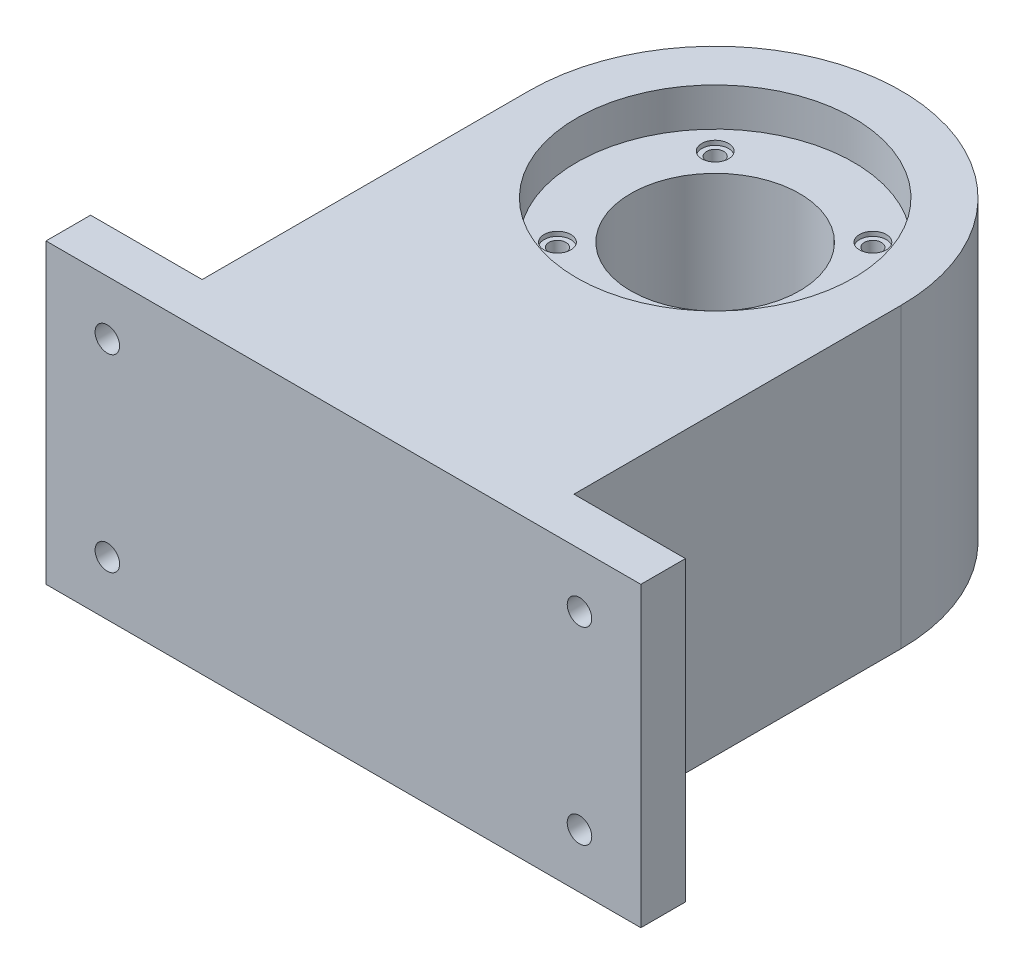
from build123d import *

# Parameters (mm, degrees)
EXTRUDE_1_DEPTH          = 80
SKETCH_3_R               = 37.25
CUT_EXTRUDE_1_DEPTH      = 10.3
SKETCH_4_R               = 22.7
CUT_EXTRUDE_2_DEPTH      = 65
CUT_EXTRUDE_3_DEPTH      = 138.477270849
SKETCH_6_W               = 160
SKETCH_6_H               = 12
EXTRUDE_2_DEPTH          = 80
SKETCH_8_R               = 5.5
CUT_EXTRUDE_4_DEPTH      = 6.8
SKETCH_9_R               = 3.3
CUT_EXTRUDE_5_DEPTH      = 179.44887223
RIB_START                = -5
RIB_1_DEPTH              = 10
PATTERN_CIRCULAR_1_COUNT = 4
EXTRUDE_3_DEPTH          = 0.1
EXTRUDE_4_DEPTH          = 0.2


# Read off the part's stored shape, not the designer's step: 筋1, 高级异型孔1, 高级异型孔2
with BuildPart() as part:
    # 草图1 → 凸台-拉伸1 (new body)
    with BuildSketch(Plane(origin=(0, 0, 0), x_dir=(1, 0, 0), z_dir=(0, 1, 0))):
        with BuildLine():
            Line((-50, -100), (0, -100))
            Line((0, -100), (0, -37.3))
            ThreePointArc((0, -37.3), (-37.3, 0), (0, 37.3))
            Line((0, 37.3), (0, 60))
            Line((0, 60), (-50, 60))
            Line((-50, 60), (-50, -100))
        make_face()
        with BuildLine():
            Line((0, -37.3), (0, -100))
            Line((0, -100), (50, -100))
            Line((50, -100), (50, 60))
            Line((50, 60), (0, 60))
            Line((0, 60), (0, 37.3))
            ThreePointArc((0, 37.3), (26.375082938, 26.375082938), (37.3, 0))
            ThreePointArc((37.3, 0), (26.375082938, -26.375082938), (0, -37.3))
        make_face()
        with BuildLine():
            ThreePointArc((0, 37.3), (-37.3, 0), (0, -37.3))
            Line((0, -37.3), (0, -16))
            ThreePointArc((0, -16), (-16, 0), (0, 16))
            Line((0, 16), (0, 37.3))
        make_face()
        with BuildLine():
            Line((0, -16), (0, -37.3))
            ThreePointArc((0, -37.3), (26.375082938, -26.375082938), (37.3, 0))
            ThreePointArc((37.3, 0), (26.375082938, 26.375082938), (0, 37.3))
            Line((0, 37.3), (0, 16))
            ThreePointArc((0, 16), (11.313708499, 11.313708499), (16, 0))
            ThreePointArc((16, 0), (11.313708499, -11.313708499), (0, -16))
        make_face()
    extrude(amount=EXTRUDE_1_DEPTH)

    # 草图3 → 切除-拉伸1 (cut)
    with BuildSketch(Plane(origin=(0, 80, 0), x_dir=(1, 0, 0), z_dir=(0, 1, 0))):
        with Locations(Location((0, 0, 0), (0, 0, 270))):
            Circle(SKETCH_3_R)
    extrude(amount=-CUT_EXTRUDE_1_DEPTH, mode=Mode.SUBTRACT)

    # 草图4 → 切除-拉伸2 (cut)
    with BuildSketch(Plane(origin=(0, 80, 0), x_dir=(1, 0, 0), z_dir=(0, 1, 0))):
        with Locations(Location((0, 0, 0), (0, 0, 270))):
            Circle(SKETCH_4_R)
    extrude(amount=-CUT_EXTRUDE_2_DEPTH, mode=Mode.SUBTRACT)

    # 草图5 → 切除-拉伸3 (cut, through all)
    with BuildSketch(Plane(origin=(0, 80, 0), x_dir=(1, 0, 0), z_dir=(0, 1, 0))):
        with BuildLine():
            ThreePointArc((-50, 1.43e-07), (7.1e-08, 50), (50, 0))
            Line((50, 0), (50, 60))
            Line((50, 60), (-50, 60))
            Line((-50, 60), (-50, 1.43e-07))
        make_face()
    extrude(amount=-CUT_EXTRUDE_3_DEPTH, mode=Mode.SUBTRACT)

    # 草图6 → 凸台-拉伸2 (add)
    with BuildSketch(Plane(origin=(0, 80, 0), x_dir=(1, 0, 0), z_dir=(0, 1, 0))):
        with Locations((0, -94)):
            Rectangle(SKETCH_6_W, SKETCH_6_H)
    extrude(amount=-EXTRUDE_2_DEPTH)

    # 草图8 → 切除-拉伸4 (cut)
    with BuildSketch(Plane(origin=(0, 0, 88), x_dir=(-1, 0, 0), z_dir=(0, 0, -1))):
        with Locations((63.5, 65.4)):
            Circle(SKETCH_8_R)
        with Locations(Location((63.5, 14.6, 0), (0, 0, 180))):
            Circle(SKETCH_8_R)
    cut_extrude_4 = extrude(amount=-CUT_EXTRUDE_4_DEPTH, mode=Mode.SUBTRACT)

    # 草图9 → 切除-拉伸5 (cut, through all)
    with BuildSketch(Plane(origin=(0, 0, 88), x_dir=(-1, 0, 0), z_dir=(0, 0, -1))):
        with Locations((63.5, 65.4)):
            Circle(SKETCH_9_R)
        with Locations((63.5, 14.6)):
            Circle(SKETCH_9_R)
    cut_extrude_5 = extrude(amount=-CUT_EXTRUDE_5_DEPTH, mode=Mode.SUBTRACT)

    # 镜向1: 切除-拉伸4, 切除-拉伸5 across plane
    add(cut_extrude_4.mirror(Plane(origin=(0, 0, 0), x_dir=(0, 0, 1), z_dir=(1, 0, 0))), mode=Mode.SUBTRACT)
    add(cut_extrude_5.mirror(Plane(origin=(0, 0, 0), x_dir=(0, 0, 1), z_dir=(1, 0, 0))), mode=Mode.SUBTRACT)

    # 筋1 outline → 筋1 (add)
    with BuildSketch(Plane(origin=(0, 40, 0), x_dir=(1, 0, 0), z_dir=(0, 1, 0)).offset(RIB_START)):
        Polygon((-50, -58), (-80, -88), (-50, -88), align=None)
    rib_1 = extrude(amount=RIB_1_DEPTH)

    # 镜向2: 筋1 across plane
    add(rib_1.mirror(Plane(origin=(0, 0, 0), x_dir=(0, 0, 1), z_dir=(1, 0, 0))))

    # 高级异型孔1 outline → 高级异型孔1 (revolve, cut)
    with BuildSketch(Plane(origin=(21.213203436, 0, -21.213203436), x_dir=(1, 0, 0), z_dir=(0, 0, 1))):
        Polygon((2.3, 68.5), (3.6, 68.5), (3.6, 69.7), (0, 69.7), (0, 57.11802058), (2.3, 58.5), align=None)
    other_1 = revolve(axis=Axis((21.213203436, 0, -21.213203436), (0, 1, 0)), mode=Mode.SUBTRACT)

    # 阵列(圆周)1: 高级异型孔1 ×4 about axis
    pattern_circular_1_axis = Axis((0, 0, 0), (0, 1, 0))
    for i in range(1, PATTERN_CIRCULAR_1_COUNT):
        add(other_1.rotate(pattern_circular_1_axis, i * 360 / PATTERN_CIRCULAR_1_COUNT), mode=Mode.SUBTRACT)

    # 高级异型孔2 outline → 高级异型孔2 (revolve, cut)
    with BuildSketch(Plane(origin=(15, 0, 55), x_dir=(1, 0, 0), z_dir=(0, 0, 1))):
        Polygon((3.6, 0), (3.6, 1.5), (2.3, 1.5), (2.3, 11.5), (0, 12.88197942), (0, 0), align=None)
    revolve(axis=Axis((15, 0, 55), (0, 1, 0)), mode=Mode.SUBTRACT)

    # Other 2 2 outline → Other 2 2 (revolve, cut)
    with BuildSketch(Plane(origin=(-15, 0, 55), x_dir=(1, 0, 0), z_dir=(0, 0, 1))):
        Polygon((0, 0), (3.6, 0), (3.6, 1.5), (2.3, 1.5), (2.3, 11.5), (0, 12.88197942), align=None)
    revolve(axis=Axis((-15, 0, 55), (0, 1, 0)), mode=Mode.SUBTRACT)

    # 草图14 → 凸台-拉伸3 (add)
    with BuildSketch(Plane.XZ.offset(-1.5)):
        with BuildLine():
            Line((-16.327905619, 57.3), (-15.607120186, 58.548436991))
            ThreePointArc((-15.607120186, 58.548436991), (-16.8, 58.117691454), (-17.769476485, 57.3))
            Line((-17.769476485, 57.3), (-16.327905619, 57.3))
        make_face()
        with BuildLine():
            Line((-17.655811238, 55), (-16.327905619, 57.3))
            Line((-16.327905619, 57.3), (-17.769476485, 57.3))
            ThreePointArc((-17.769476485, 57.3), (-18.117691454, 56.8), (-18.376596671, 56.248436991))
            Line((-18.376596671, 56.248436991), (-17.655811238, 55))
        make_face()
        with BuildLine():
            Line((-18.376596671, 53.751563009), (-17.655811238, 55))
            Line((-17.655811238, 55), (-18.376596671, 56.248436991))
            ThreePointArc((-18.376596671, 56.248436991), (-18.6, 55), (-18.376596671, 53.751563009))
        make_face()
        with BuildLine():
            Line((-15.607120186, 51.451563009), (-16.327905619, 52.7))
            Line((-16.327905619, 52.7), (-17.769476485, 52.7))
            ThreePointArc((-17.769476485, 52.7), (-16.8, 51.882308546), (-15.607120186, 51.451563009))
        make_face()
        with BuildLine():
            Line((-13.672094381, 52.7), (-16.327905619, 52.7))
            Line((-16.327905619, 52.7), (-15.607120186, 51.451563009))
            ThreePointArc((-15.607120186, 51.451563009), (-15, 51.4), (-14.392879814, 51.451563009))
            Line((-14.392879814, 51.451563009), (-13.672094381, 52.7))
        make_face()
        with BuildLine():
            Line((-12.230523515, 52.7), (-13.672094381, 52.7))
            Line((-13.672094381, 52.7), (-14.392879814, 51.451563009))
            ThreePointArc((-14.392879814, 51.451563009), (-13.2, 51.882308546), (-12.230523515, 52.7))
        make_face()
        with BuildLine():
            Line((-11.623403329, 56.248436991), (-12.344188762, 55))
            Line((-12.344188762, 55), (-11.623403329, 53.751563009))
            ThreePointArc((-11.623403329, 53.751563009), (-11.456290925, 54.365865951), (-11.4, 55))
            ThreePointArc((-11.4, 55), (-11.456290925, 55.634134049), (-11.623403329, 56.248436991))
        make_face()
        with BuildLine():
            Line((-12.230523515, 57.3), (-13.672094381, 57.3))
            Line((-13.672094381, 57.3), (-12.344188762, 55))
            Line((-12.344188762, 55), (-11.623403329, 56.248436991))
            ThreePointArc((-11.623403329, 56.248436991), (-11.882308546, 56.8), (-12.230523515, 57.3))
        make_face()
        with BuildLine():
            ThreePointArc((-12.230523515, 57.3), (-13.2, 58.117691454), (-14.392879814, 58.548436991))
            Line((-14.392879814, 58.548436991), (-13.672094381, 57.3))
            Line((-13.672094381, 57.3), (-12.230523515, 57.3))
        make_face()
    extrude_3 = extrude(amount=EXTRUDE_3_DEPTH)

    # 草图14<3> → 凸台-拉伸4 (add)
    with BuildSketch(Plane.XZ.offset(-1.5)):
        with BuildLine():
            Line((-16.327905619, 52.7), (-17.655811238, 55))
            Line((-17.655811238, 55), (-18.376596671, 53.751563009))
            ThreePointArc((-18.376596671, 53.751563009), (-18.117691454, 53.2), (-17.769476485, 52.7))
            Line((-17.769476485, 52.7), (-16.327905619, 52.7))
        make_face()
        with BuildLine():
            Line((-18.376596671, 53.751563009), (-17.655811238, 55))
            Line((-17.655811238, 55), (-18.376596671, 56.248436991))
            ThreePointArc((-18.376596671, 56.248436991), (-18.6, 55), (-18.376596671, 53.751563009))
        make_face()
        with BuildLine():
            Line((-15.607120186, 51.451563009), (-16.327905619, 52.7))
            Line((-16.327905619, 52.7), (-17.769476485, 52.7))
            ThreePointArc((-17.769476485, 52.7), (-16.8, 51.882308546), (-15.607120186, 51.451563009))
        make_face()
        with BuildLine():
            Line((-12.230523515, 52.7), (-13.672094381, 52.7))
            Line((-13.672094381, 52.7), (-14.392879814, 51.451563009))
            ThreePointArc((-14.392879814, 51.451563009), (-13.2, 51.882308546), (-12.230523515, 52.7))
        make_face()
        with BuildLine():
            Line((-11.623403329, 53.751563009), (-12.344188762, 55))
            Line((-12.344188762, 55), (-13.672094381, 52.7))
            Line((-13.672094381, 52.7), (-12.230523515, 52.7))
            ThreePointArc((-12.230523515, 52.7), (-11.882308546, 53.2), (-11.623403329, 53.751563009))
        make_face()
        with BuildLine():
            Line((-11.623403329, 56.248436991), (-12.344188762, 55))
            Line((-12.344188762, 55), (-11.623403329, 53.751563009))
            ThreePointArc((-11.623403329, 53.751563009), (-11.456290925, 54.365865951), (-11.4, 55))
            ThreePointArc((-11.4, 55), (-11.456290925, 55.634134049), (-11.623403329, 56.248436991))
        make_face()
        with BuildLine():
            ThreePointArc((-12.230523515, 57.3), (-13.2, 58.117691454), (-14.392879814, 58.548436991))
            Line((-14.392879814, 58.548436991), (-13.672094381, 57.3))
            Line((-13.672094381, 57.3), (-12.230523515, 57.3))
        make_face()
        with BuildLine():
            ThreePointArc((-14.392879814, 58.548436991), (-15, 58.6), (-15.607120186, 58.548436991))
            Line((-15.607120186, 58.548436991), (-16.327905619, 57.3))
            Line((-16.327905619, 57.3), (-13.672094381, 57.3))
            Line((-13.672094381, 57.3), (-14.392879814, 58.548436991))
        make_face()
        with BuildLine():
            Line((-16.327905619, 57.3), (-15.607120186, 58.548436991))
            ThreePointArc((-15.607120186, 58.548436991), (-16.8, 58.117691454), (-17.769476485, 57.3))
            Line((-17.769476485, 57.3), (-16.327905619, 57.3))
        make_face()
    extrude_4 = extrude(amount=EXTRUDE_4_DEPTH)

    # 镜向3: 凸台-拉伸3, 凸台-拉伸4 across plane
    add(extrude_3.mirror(Plane(origin=(0, 0, 0), x_dir=(0, 0, 1), z_dir=(1, 0, 0))))
    add(extrude_4.mirror(Plane(origin=(0, 0, 0), x_dir=(0, 0, 1), z_dir=(1, 0, 0))))


solid = part.part
